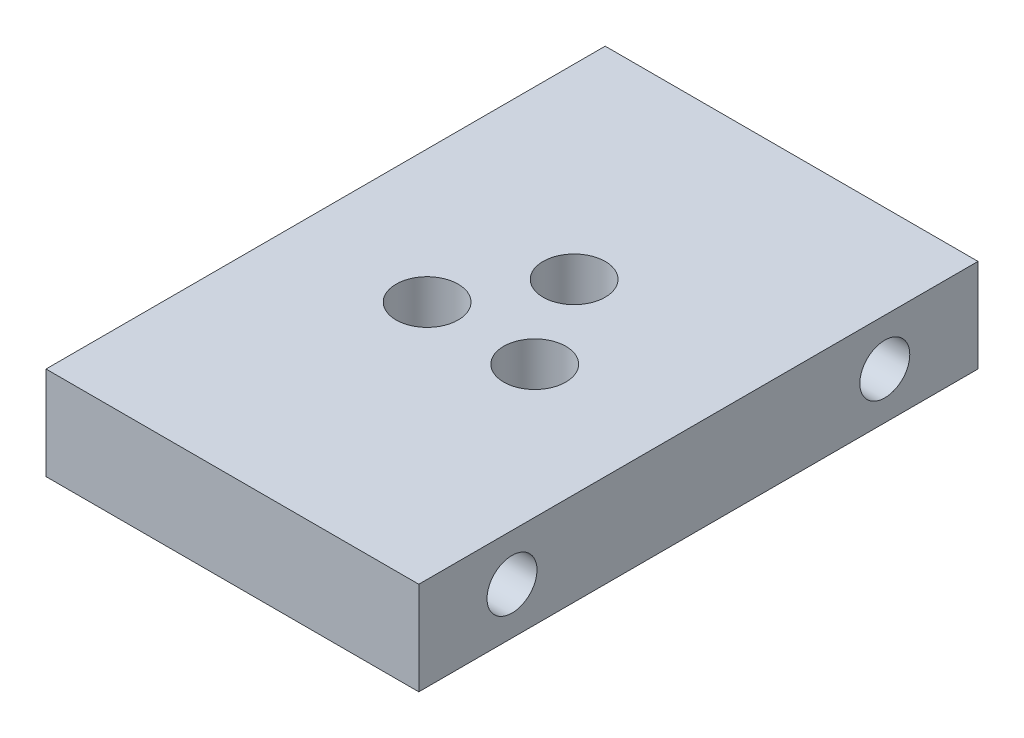
from build123d import *

# Parameters (mm, degrees)
SKETCH1_W                             = 38.1
SKETCH1_H                             = 57.15
BOSS_EXTRUDE1_DEPTH                   = 9.525
F_1_4_0_25_DIAMETER_HOLE1_D           = 6.35
F_1_4_0_25_DIAMETER_HOLE1_DEPTH       = 17.018
F_1_4_0_25_DIAMETER_HOLE1_TIP         = 1.907732465
F_1_4_20_TAPPED_HOLE1_D               = 5.1054
F_1_4_20_TAPPED_HOLE1_DEPTH           = 16.51
F_1_4_20_TAPPED_HOLE1_TIP             = 1.533816902
F_1_4_20_TAPPED_HOLE1_ON_FACE_2_D     = 5.1054
F_1_4_20_TAPPED_HOLE1_ON_FACE_2_DEPTH = 16.51
F_1_4_20_TAPPED_HOLE1_ON_FACE_2_TIP   = 1.533816902


with BuildPart() as part:
    # Sketch1 → Boss-Extrude1 (new body)
    with BuildSketch(Plane(origin=(0, 0, 0), x_dir=(1, 0, 0), z_dir=(0, 1, 0))):
        Rectangle(SKETCH1_W, SKETCH1_H)
    extrude(amount=BOSS_EXTRUDE1_DEPTH)

    # 1/4 (0.25) Diameter Hole1
    with Locations(Plane(origin=(0, 0, 0), x_dir=(-1, 0, 0), z_dir=(0, -1, 0))):
        with Locations((0, 6.35), (5.499261314, -3.175), (-5.499261314, -3.175)):
            Hole(F_1_4_0_25_DIAMETER_HOLE1_D / 2, depth=F_1_4_0_25_DIAMETER_HOLE1_DEPTH)
            with Locations((0, 0, -(F_1_4_0_25_DIAMETER_HOLE1_DEPTH + F_1_4_0_25_DIAMETER_HOLE1_TIP / 2))):  # 118° drill point
                Cone(0, F_1_4_0_25_DIAMETER_HOLE1_D / 2, F_1_4_0_25_DIAMETER_HOLE1_TIP, mode=Mode.SUBTRACT)

    # 1/4-20 Tapped Hole1
    with Locations(Plane(origin=(-19.05, 4.7625, -19.05), x_dir=(0, 0, -1), z_dir=(-1, 0, 0))):
        with Locations((0, 0), (-38.1, 0)):
            Hole(F_1_4_20_TAPPED_HOLE1_D / 2, depth=F_1_4_20_TAPPED_HOLE1_DEPTH)
            with Locations((0, 0, -(F_1_4_20_TAPPED_HOLE1_DEPTH + F_1_4_20_TAPPED_HOLE1_TIP / 2))):  # 118° drill point
                Cone(0, F_1_4_20_TAPPED_HOLE1_D / 2, F_1_4_20_TAPPED_HOLE1_TIP, mode=Mode.SUBTRACT)

    # 1/4-20 Tapped Hole1 on face 2
    with Locations(Plane(origin=(19.05, 4.7625, 19.05), x_dir=(0, 0, 1), z_dir=(1, 0, 0))):
        with Locations((0, 0), (-38.1, 0)):
            Hole(F_1_4_20_TAPPED_HOLE1_ON_FACE_2_D / 2, depth=F_1_4_20_TAPPED_HOLE1_ON_FACE_2_DEPTH)
            with Locations((0, 0, -(F_1_4_20_TAPPED_HOLE1_ON_FACE_2_DEPTH + F_1_4_20_TAPPED_HOLE1_ON_FACE_2_TIP / 2))):  # 118° drill point
                Cone(0, F_1_4_20_TAPPED_HOLE1_ON_FACE_2_D / 2, F_1_4_20_TAPPED_HOLE1_ON_FACE_2_TIP, mode=Mode.SUBTRACT)


solid = part.part
